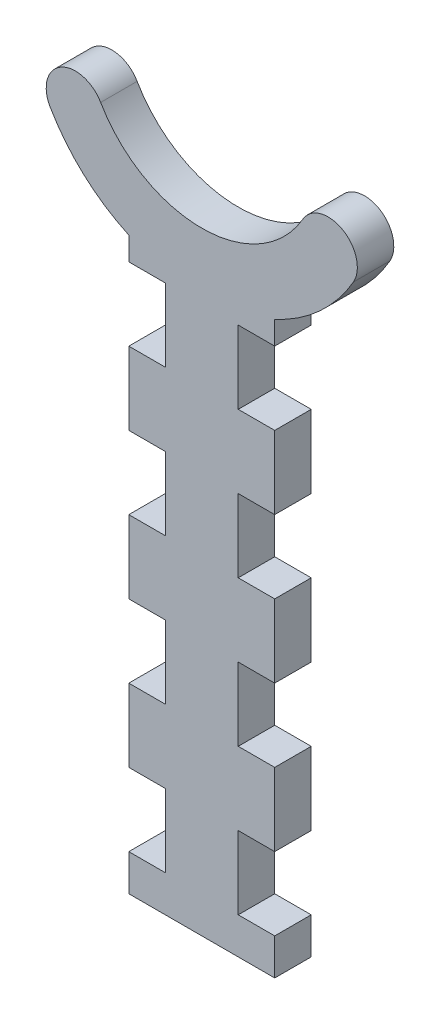
from build123d import *

# Parameters (mm, degrees)
EXTRUDE_1_DEPTH     = 5
SKETCH_2_W          = 5
SKETCH_2_H          = 10
CUT_EXTRUDE_1_DEPTH = 103.369741939


with BuildPart() as part:
    # ｽｹｯﾁ1 → ﾎﾞｽ - 押し出し1 (new body)
    with BuildSketch(Plane.XY):
        with BuildLine():
            Line((-10, -21.817424229), (-10, -100))
            Line((-10, -100), (10, -100))
            Line((10, -100), (10, -21.817424229))
            ThreePointArc((10, -21.817424229), (16.156067067, -17.747718076), (20.784609691, -12))
            ThreePointArc((20.784609691, -12), (19.320508076, -6.535898385), (13.856406461, -8))
            ThreePointArc((13.856406461, -8), (0, -16), (-13.856406461, -8))
            ThreePointArc((-13.856406461, -8), (-19.320508076, -6.535898385), (-20.784609691, -12))
            ThreePointArc((-20.784609691, -12), (-16.156067067, -17.747718076), (-10, -21.817424229))
        make_face()
    extrude(amount=EXTRUDE_1_DEPTH)

    # ｽｹｯﾁ2 → ｶｯﾄ - 押し出し1 (cut, through all)
    with BuildSketch(Plane.XY.offset(5)):
        with Locations((7.5, -90)):
            Rectangle(SKETCH_2_W, SKETCH_2_H)
        with Locations((7.5, -70)):
            Rectangle(SKETCH_2_W, SKETCH_2_H)
        with Locations((7.5, -50)):
            Rectangle(SKETCH_2_W, SKETCH_2_H)
        with Locations((7.5, -30)):
            Rectangle(SKETCH_2_W, SKETCH_2_H)
        with Locations((-7.5, -90)):
            Rectangle(SKETCH_2_W, SKETCH_2_H)
        with Locations((-7.5, -70)):
            Rectangle(SKETCH_2_W, SKETCH_2_H)
        with Locations((-7.5, -50)):
            Rectangle(SKETCH_2_W, SKETCH_2_H)
        with Locations((-7.5, -30)):
            Rectangle(SKETCH_2_W, SKETCH_2_H)
    extrude(amount=-CUT_EXTRUDE_1_DEPTH, mode=Mode.SUBTRACT)


solid = part.part
